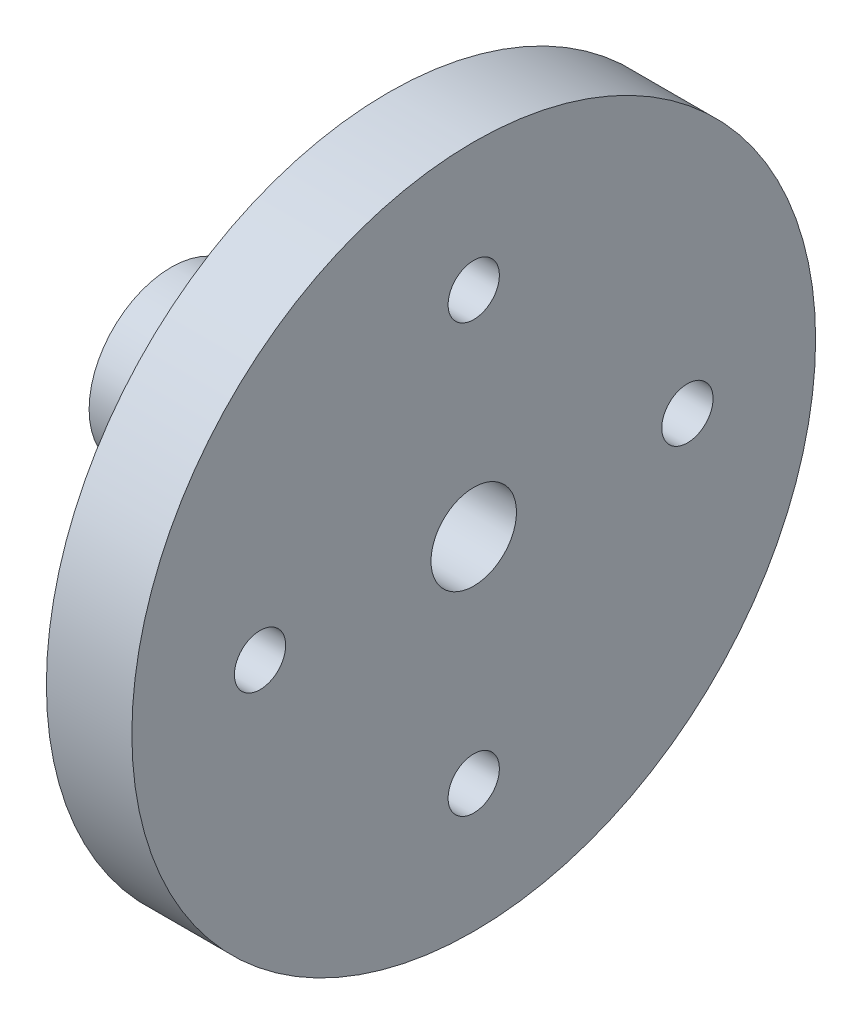
from build123d import *
from build123d.topology import SkipClean

# Parameters (mm, degrees)
SKETCH1_R                    = 20
SKETCH1_R_2                  = 2.5
BOSS_EXTRUDE1_DEPTH          = 5
BOSS_EXTRUDE2_START          = 12.7
SKETCH3_R                    = 4.8
SKETCH3_R_2                  = 2.5
BOSS_EXTRUDE2_DEPTH          = 12.7
F_3_0_3_DIAMETER_HOLE1_D     = 3
F_3_0_3_DIAMETER_HOLE1_DEPTH = 15
F_3_0_3_DIAMETER_HOLE1_TIP   = 0.901290929


with BuildPart() as part:
    # Sketch1 → Boss-Extrude1 (new body)
    with BuildSketch(Plane(origin=(0, 0, 0), x_dir=(0, 0, -1), z_dir=(1, 0, 0))):
        Circle(SKETCH1_R)
        Circle(SKETCH1_R_2, mode=Mode.SUBTRACT)
    extrude(amount=BOSS_EXTRUDE1_DEPTH)

    # Sketch3 → Boss-Extrude2 (add)
    with SkipClean():  # the faces are left unmerged after this step: merging them gives an invalid solid
        with BuildSketch(Plane.ZY.offset(BOSS_EXTRUDE2_START)):
            Circle(SKETCH3_R)
            Circle(SKETCH3_R_2, mode=Mode.SUBTRACT)
        extrude(amount=-BOSS_EXTRUDE2_DEPTH)

    # Ø3.0 (3) Diameter Hole1
    with Locations(Plane(origin=(5, 0, 0), x_dir=(0, 0, -1), z_dir=(1, 0, 0))):
        with Locations((12.5, 0), (0, -12.5), (-12.5, 0), (0, 12.5)):
            Hole(F_3_0_3_DIAMETER_HOLE1_D / 2, depth=F_3_0_3_DIAMETER_HOLE1_DEPTH)
            with Locations((0, 0, -(F_3_0_3_DIAMETER_HOLE1_DEPTH + F_3_0_3_DIAMETER_HOLE1_TIP / 2))):  # 118° drill point
                Cone(0, F_3_0_3_DIAMETER_HOLE1_D / 2, F_3_0_3_DIAMETER_HOLE1_TIP, mode=Mode.SUBTRACT)


solid = part.part
